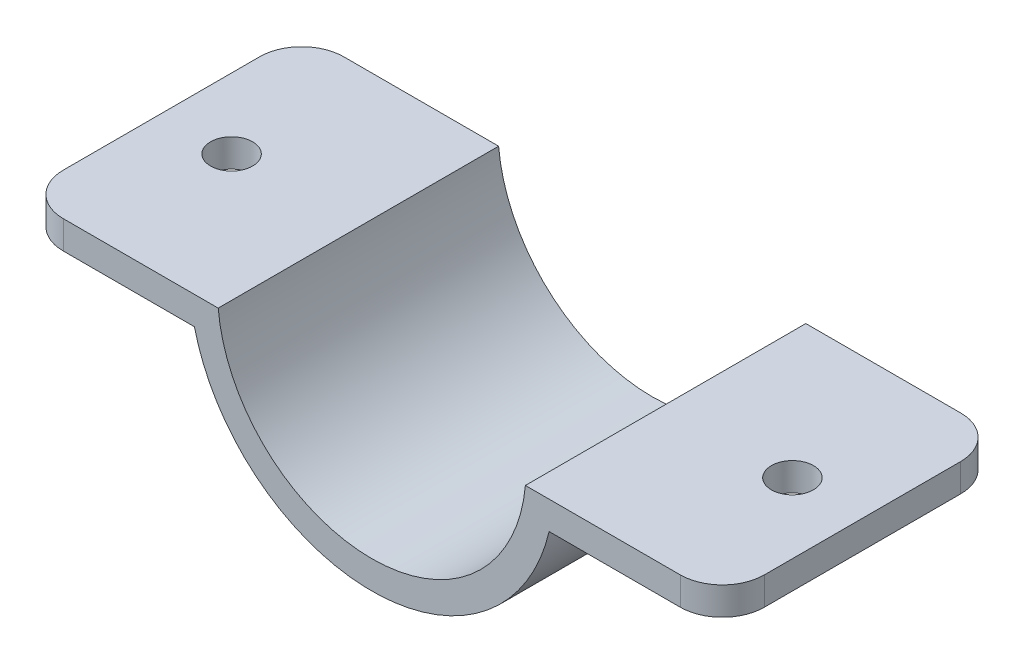
from build123d import *

# Parameters (mm, degrees)
BOSS_EXTRUDE1_DEPTH = 20
SKETCH2_R           = 1.5
CUT_EXTRUDE1_DEPTH  = 20
FILLET1_R           = 3


with BuildPart() as part:
    # Sketch1 → Boss-Extrude1 (new body)
    with BuildSketch(Plane.XY):
        with BuildLine():
            Line((-25, -1), (-25, -3))
            Line((-25, -3), (-12.649110641, -3))
            ThreePointArc((-12.649110641, -3), (0, -13), (12.649110641, -3))
            Line((12.649110641, -3), (25, -3))
            Line((25, -3), (25, -1))
            Line((25, -1), (10.95445115, -1))
            ThreePointArc((10.95445115, -1), (0, -11), (-10.95445115, -1))
            Line((-10.95445115, -1), (-25, -1))
        make_face()
    extrude(amount=BOSS_EXTRUDE1_DEPTH)

    # Sketch2 → Cut-Extrude1 (cut)
    with BuildSketch(Plane.XZ.offset(3)):
        with Locations((-20, 10)):
            Circle(SKETCH2_R)
    cut_extrude1 = extrude(amount=-CUT_EXTRUDE1_DEPTH, mode=Mode.SUBTRACT)

    # Mirror1: Cut-Extrude1 across plane
    add(cut_extrude1.mirror(Plane(origin=(0, 0, 0), x_dir=(0, 0, 1), z_dir=(1, 0, 0))), mode=Mode.SUBTRACT)

    # Fillet1
    fillet1_edges = [part.edges().sort_by_distance(p)[0] for p in [
        (25, -2, 0),
        (25, -2, 20),
        (-25, -2, 20),
        (-25, -2, 0),
    ]]
    fillet(fillet1_edges, radius=FILLET1_R)


solid = part.part
